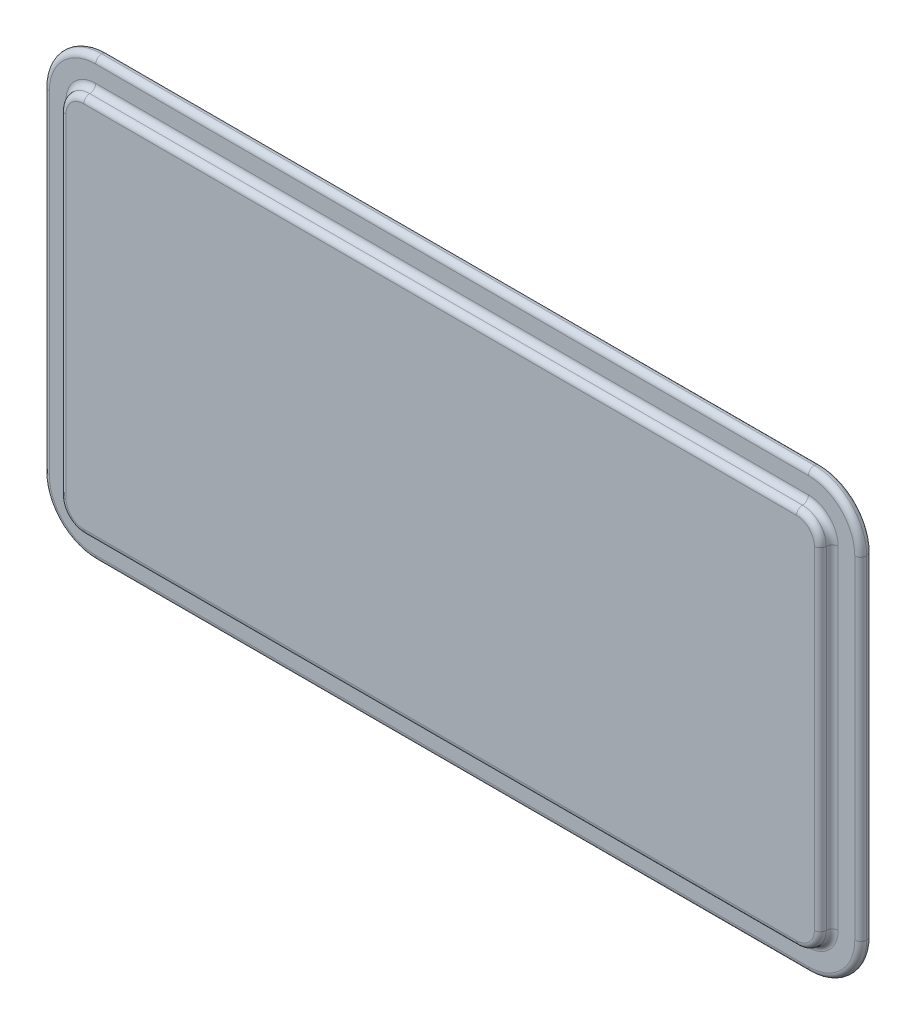
from build123d import *

# Parameters (mm, degrees)
BOSS_EXTRUDE2_DEPTH = 5
BOSS_EXTRUDE3_DEPTH = 5
FILLET4_R           = 2.5


with BuildPart() as part:
    # Sketch3 → Boss-Extrude2 (new body)
    with BuildSketch(Plane.XY):
        with BuildLine():
            Line((-150, 80), (150, 80))
            ThreePointArc((150, 80), (157.071067812, 77.071067812), (160, 70))
            Line((160, 70), (160, -70))
            ThreePointArc((160, -70), (157.071067812, -77.071067812), (150, -80))
            Line((150, -80), (-150, -80))
            ThreePointArc((-150, -80), (-157.071067812, -77.071067812), (-160, -70))
            Line((-160, -70), (-160, 70))
            ThreePointArc((-160, 70), (-157.071067812, 77.071067812), (-150, 80))
        make_face()
    extrude(amount=BOSS_EXTRUDE2_DEPTH)

    # Sketch4 → Boss-Extrude3 (add)
    with BuildSketch(Plane(origin=(0, 0, 0), x_dir=(-1, 0, 0), z_dir=(0, 0, -1))):
        with BuildLine():
            Line((150, 92), (-150, 92))
            ThreePointArc((-150, 92), (-165.556349186, 85.556349186), (-172, 70))
            Line((-172, 70), (-172, -70))
            ThreePointArc((-172, -70), (-165.556349186, -85.556349186), (-150, -92))
            Line((-150, -92), (150, -92))
            ThreePointArc((150, -92), (165.556349186, -85.556349186), (172, -70))
            Line((172, -70), (172, 70))
            ThreePointArc((172, 70), (165.556349186, 85.556349186), (150, 92))
        make_face()
    extrude(amount=BOSS_EXTRUDE3_DEPTH)

    # Fillet4
    fillet4_edges = [part.edges().sort_by_distance(p)[0] for p in [
        (-157.071067812, 77.071067812, 5),
        (0, 80, 5),
        (157.071067812, 77.071067812, 5),
        (160, 0, 5),
        (157.071067812, -77.071067812, 5),
        (-160, 0, 5),
        (0, -80, 5),
        (-157.071067812, -77.071067812, 5),
        (-157.071067812, 77.071067812, 0),
        (0, 80, 0),
        (157.071067812, 77.071067812, 0),
        (160, 0, 0),
        (157.071067812, -77.071067812, 0),
        (0, -80, 0),
        (-157.071067812, -77.071067812, 0),
        (-160, 0, 0),
        (-165.556349186, -85.556349186, -5),
        (0, -92, -5),
        (165.556349186, -85.556349186, -5),
        (172, 0, -5),
        (165.556349186, 85.556349186, -5),
        (0, 92, -5),
        (-165.556349186, 85.556349186, -5),
        (-165.556349186, -85.556349186, 0),
        (0, -92, 0),
        (165.556349186, -85.556349186, 0),
        (172, 0, 0),
        (165.556349186, 85.556349186, 0),
        (0, 92, 0),
        (-165.556349186, 85.556349186, 0),
        (-172, 0, -5),
        (-172, 0, 0),
    ]]
    fillet(fillet4_edges, radius=FILLET4_R - 0.0001)  # a hair under: the kernel refuses the full size


solid = part.part
